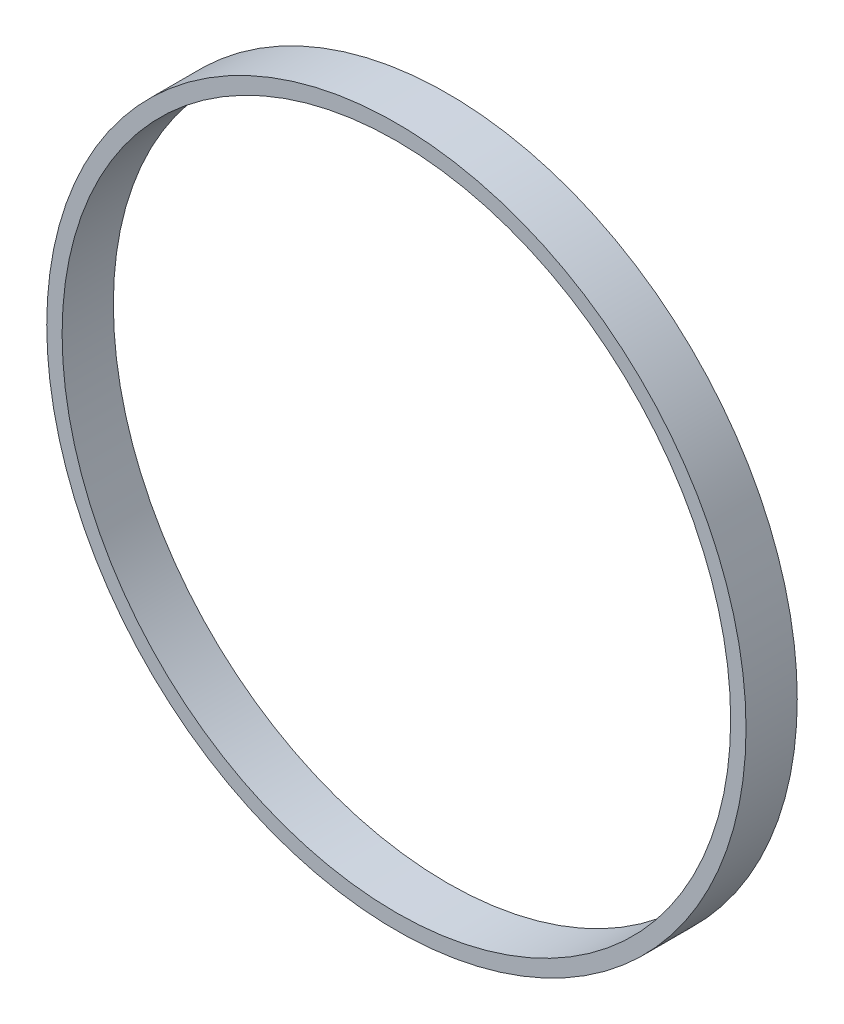
from build123d import *

# Parameters (mm, degrees)
SKETCH_1_R      = 40.95
SKETCH_1_R_2    = 39.15
EXTRUDE_1_DEPTH = 6


with BuildPart() as part:
    # 草图1 → 凸台-拉伸1 (new body)
    with BuildSketch(Plane.XY):
        Circle(SKETCH_1_R)
        Circle(SKETCH_1_R_2, mode=Mode.SUBTRACT)
    extrude_1 = extrude(amount=EXTRUDE_1_DEPTH)

    # 镜向1: 凸台-拉伸1 across plane
    add(extrude_1.mirror(Plane(origin=(0, 0, 0), x_dir=(0, 0, 1), z_dir=(1, 0, 0))))

    # 镜向2: 凸台-拉伸1 across plane
    add(extrude_1.mirror(Plane.ZX))


solid = part.part
